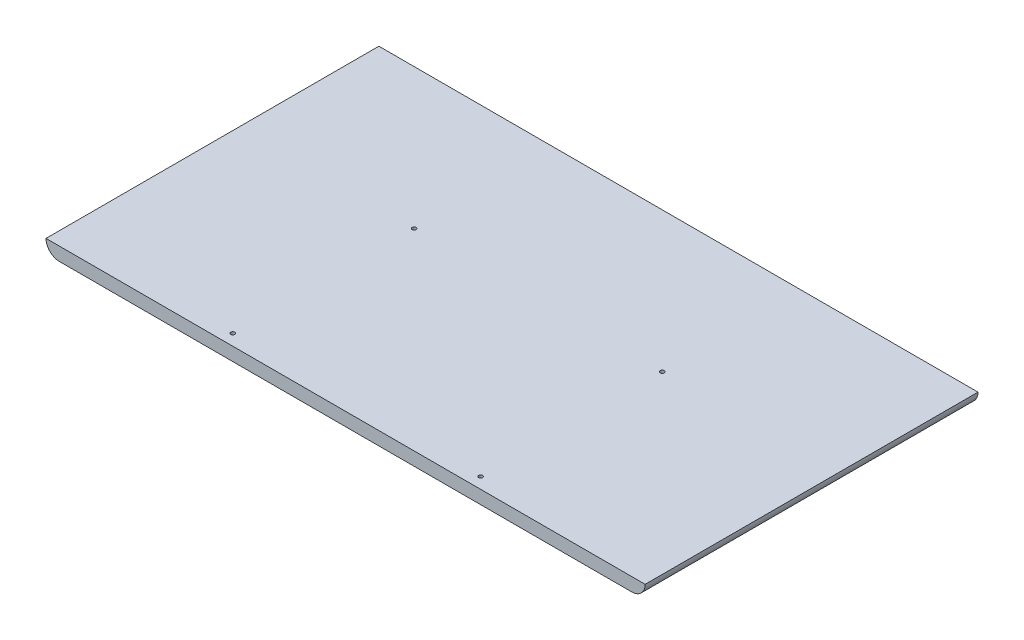
from build123d import *

# Parameters (mm, degrees)
SKETCH1_W           = 450
SKETCH1_H           = 10
BOSS_EXTRUDE2_DEPTH = 250
SKETCH2_R           = 3
CUT_EXTRUDE1_DEPTH  = 20
FILLET1_R           = 10
FILLET2_R           = 10
SKETCH4_R           = 1.5
CUT_EXTRUDE3_DEPTH  = 10
SKETCH5_R           = 3
BOSS_EXTRUDE3_DEPTH = 61
SKETCH6_R           = 1.5
CUT_EXTRUDE4_DEPTH  = 20


with BuildPart() as part:
    # Sketch1 → Boss-Extrude2 (new body)
    with BuildSketch(Plane.XY):
        with Locations((210.039371405, -5.47146824)):
            Rectangle(SKETCH1_W, SKETCH1_H)
    extrude(amount=BOSS_EXTRUDE2_DEPTH)

    # Sketch2 → Cut-Extrude1 (cut)
    with BuildSketch(Plane(origin=(0, 0, 0), x_dir=(-1, 0, 0), z_dir=(0, 0, -1))):
        with Locations((-25.039371405, -5.47146824)):
            Circle(SKETCH2_R)
        with Locations((-210.039371405, -5.47146824)):
            Circle(SKETCH2_R)
        with Locations((-395.039371405, -5.47146824)):
            Circle(SKETCH2_R)
    extrude(amount=-CUT_EXTRUDE1_DEPTH, mode=Mode.SUBTRACT)

    # Fillet1
    fillet1_edges = [part.edges().sort_by_distance(p)[0] for p in [
        (-14.960628595, -10.47146824, 125),
    ]]
    fillet(fillet1_edges, radius=FILLET1_R - 0.0001)  # a hair under: the kernel refuses the full size

    # Fillet2
    fillet2_edges = [part.edges().sort_by_distance(p)[0] for p in [
        (435.039371405, -10.47146824, 125),
    ]]
    fillet(fillet2_edges, radius=FILLET2_R - 0.0001)  # a hair under: the kernel refuses the full size

    # Sketch4 → Cut-Extrude3 (cut)
    with BuildSketch(Plane(origin=(0, -0.47146824, 0), x_dir=(1, 0, 0), z_dir=(0, 1, 0))):
        with Locations(Location((303.189371405, -241.66, 0), (0, 0, 180))):
            Circle(SKETCH4_R)
        with Locations(Location((116.879371405, -241.66, 0), (0, 0, 180))):
            Circle(SKETCH4_R)
        with Locations(Location((116.879371405, -105.35, 0), (0, 0, 180))):
            Circle(SKETCH4_R)
        with Locations(Location((303.189371405, -105.35, 0), (0, 0, 180))):
            Circle(SKETCH4_R)
    extrude(amount=-CUT_EXTRUDE3_DEPTH, mode=Mode.SUBTRACT)

    # Sketch5 → Boss-Extrude3 (add)
    with BuildSketch(Plane(origin=(0, 0, 0), x_dir=(-1, 0, 0), z_dir=(0, 0, -1))):
        with Locations((-395.039371405, -5.47146824)):
            Circle(SKETCH5_R)
        with Locations((-210.039371405, -5.47146824)):
            Circle(SKETCH5_R)
        with Locations((-25.039371405, -5.47146824)):
            Circle(SKETCH5_R)
    extrude(amount=-BOSS_EXTRUDE3_DEPTH)

    # Sketch6 → Cut-Extrude4 (cut)
    with BuildSketch(Plane(origin=(0, 0, 0), x_dir=(-1, 0, 0), z_dir=(0, 0, -1))):
        with Locations((-395.353101739, -5.47146824)):
            Circle(SKETCH6_R)
        with Locations((-210.039371405, -5.47146824)):
            Circle(SKETCH6_R)
        with Locations((-25.039371405, -5.47146824)):
            Circle(SKETCH6_R)
    extrude(amount=-CUT_EXTRUDE4_DEPTH, mode=Mode.SUBTRACT)


solid = part.part
